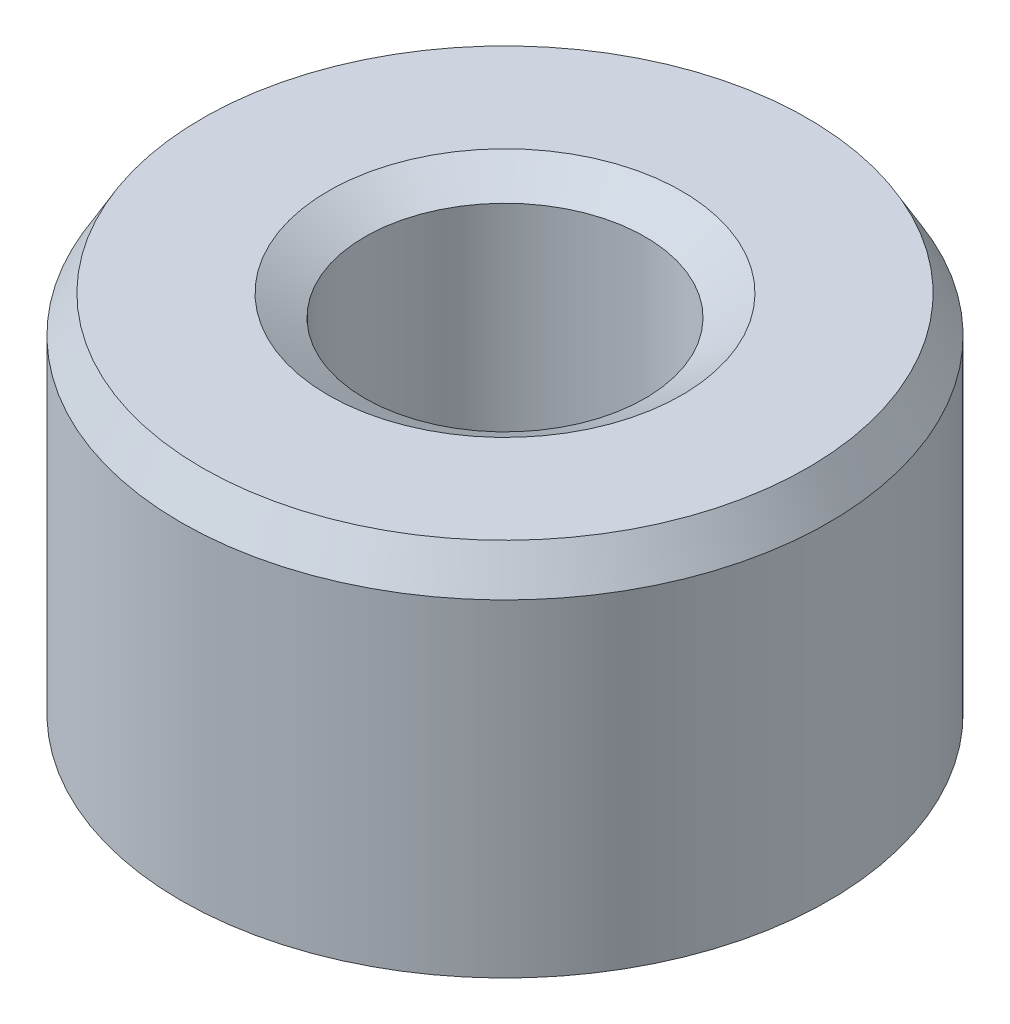
from build123d import *
from OCP.BRepFilletAPI import BRepFilletAPI_MakeChamfer

# Parameters (mm, degrees)
SKETCH1_R           = 17.5
BOSS_EXTRUDE1_DEPTH = 20.815344012
SKETCH2_R           = 7.566111699
CUT_EXTRUDE1_DEPTH  = 33.338499445
CHAMFER1_SIZE       = 1.983768357
CHAMFER1_SIZE2      = 1.145329195


with BuildPart() as part:
    # Sketch1 → Boss-Extrude1 (new body)
    with BuildSketch(Plane(origin=(0, 0, 0), x_dir=(1, 0, 0), z_dir=(0, 1, 0))):
        Circle(SKETCH1_R)
    extrude(amount=BOSS_EXTRUDE1_DEPTH)

    # Sketch2 → Cut-Extrude1 (cut, through all)
    with BuildSketch(Plane(origin=(0, 0, 0), x_dir=(1, 0, 0), z_dir=(0, 1, 0))):
        Circle(SKETCH2_R)
    extrude(amount=CUT_EXTRUDE1_DEPTH, mode=Mode.SUBTRACT)

    # Chamfer1: one chamfer whose edges measure the first distance from different faces: ONE call of the kernel's chamfer builder (chamfer() names one face for all edges)
    chamfer1_edges_1 = [part.edges().sort_by_distance(p)[0] for p in [
        (-7.566111699, 20.815344012, 0),
    ]]
    chamfer1_side_1 = [part.faces().sort_by_distance(p)[0] for p in [
        (-17.005025253, 20.815344012, 0),
    ]]
    chamfer1_edges_2 = [part.edges().sort_by_distance(p)[0] for p in [
        (-7.566111699, 0, 0),
    ]]
    chamfer1_side_2 = [part.faces().sort_by_distance(p)[0] for p in [
        (-7.566111699, 10.407672006, 0),
    ]]
    chamfer1_edges_3 = [part.edges().sort_by_distance(p)[0] for p in [
        (-17.5, 0, 0),
    ]]
    chamfer1_side_3 = [part.faces().sort_by_distance(p)[0] for p in [
        (-17.005025253, 0, 0),
    ]]
    chamfer1_edges_4 = [part.edges().sort_by_distance(p)[0] for p in [
        (-17.5, 20.815344012, 0),
    ]]
    chamfer1_side_4 = [part.faces().sort_by_distance(p)[0] for p in [
        (-17.5, 10.407672006, 0),
    ]]
    chamfer1 = BRepFilletAPI_MakeChamfer(part.part.solid().wrapped)
    for e in chamfer1_edges_1:
        chamfer1.Add(CHAMFER1_SIZE, CHAMFER1_SIZE2, e.wrapped, chamfer1_side_1[0].wrapped)  # the first distance lies on this face
    for e in chamfer1_edges_2:
        chamfer1.Add(CHAMFER1_SIZE, CHAMFER1_SIZE2, e.wrapped, chamfer1_side_2[0].wrapped)  # the first distance lies on this face
    for e in chamfer1_edges_3:
        chamfer1.Add(CHAMFER1_SIZE, CHAMFER1_SIZE2, e.wrapped, chamfer1_side_3[0].wrapped)  # the first distance lies on this face
    for e in chamfer1_edges_4:
        chamfer1.Add(CHAMFER1_SIZE, CHAMFER1_SIZE2, e.wrapped, chamfer1_side_4[0].wrapped)  # the first distance lies on this face
    add(Compound.cast(chamfer1.Shape()), mode=Mode.REPLACE)


solid = part.part
